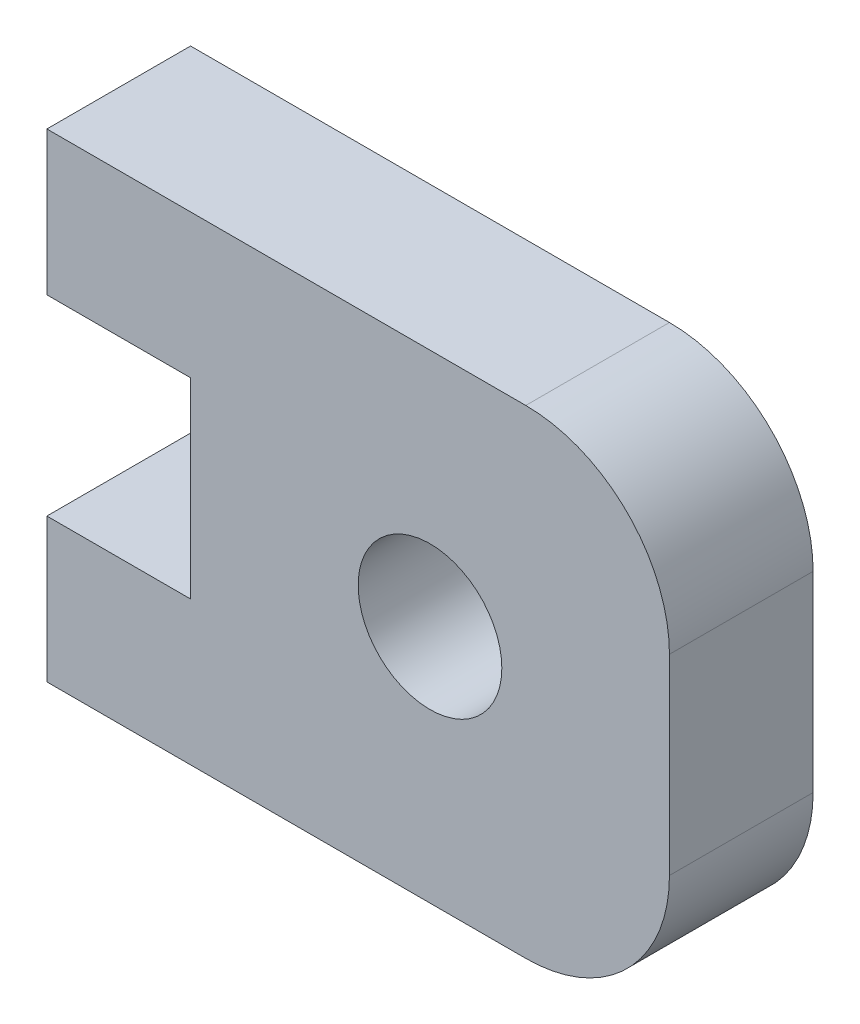
from build123d import *

# Parameters (mm, degrees)
SKETCH1_R           = 1.5
BOSS_EXTRUDE1_DEPTH = 3


with BuildPart() as part:
    # Sketch1 → Boss-Extrude1 (new body)
    with BuildSketch(Plane.XY):
        with BuildLine():
            Line((0, 10), (10, 10))
            ThreePointArc((10, 10), (12.121320344, 9.121320344), (13, 7))
            Line((13, 7), (13, 3))
            ThreePointArc((13, 3), (12.121320344, 0.878679656), (10, 0))
            Line((10, 0), (0, 0))
            Line((0, 0), (0, 3))
            Line((0, 3), (3, 3))
            Line((3, 3), (3, 7))
            Line((3, 7), (0, 7))
            Line((0, 7), (0, 10))
        make_face()
        with Locations((8, 5)):
            Circle(SKETCH1_R, mode=Mode.SUBTRACT)
    extrude(amount=BOSS_EXTRUDE1_DEPTH)


solid = part.part
